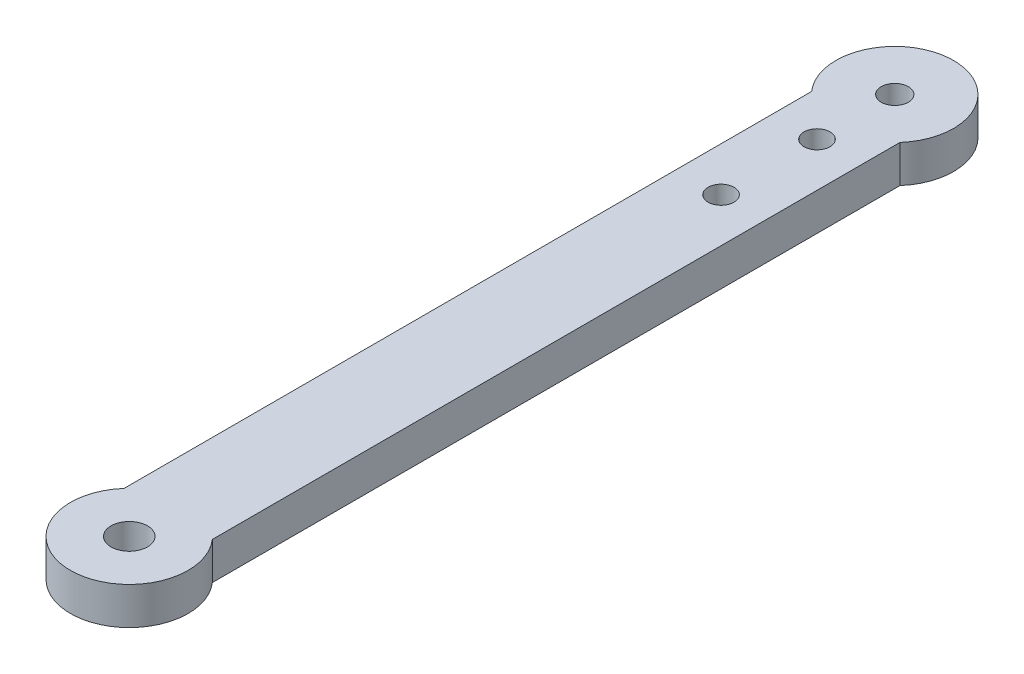
from build123d import *

# Parameters (mm, degrees)
SKETCH1_R           = 1.55
SKETCH1_R_2         = 1.1
SKETCH1_R_3         = 1.15
BOSS_EXTRUDE1_DEPTH = 3.175


with BuildPart() as part:
    # Sketch1 → Boss-Extrude1 (new body)
    with BuildSketch(Plane(origin=(0, 0, 0), x_dir=(1, 0, 0), z_dir=(0, 1, 0))):
        with BuildLine():
            Line((-3.75, -61.692810861), (-3.75, -3.307189139))
            ThreePointArc((-3.75, -3.307189139), (0, 5), (3.75, -3.307189139))
            Line((3.75, -3.307189139), (3.75, -61.692810861))
            ThreePointArc((3.75, -61.692810861), (0, -70), (-3.75, -61.692810861))
        make_face()
        with Locations((0, -65)):
            Circle(SKETCH1_R, mode=Mode.SUBTRACT)
        with Locations((0, -6.6)):
            Circle(SKETCH1_R_2, mode=Mode.SUBTRACT)
        with Locations((0, -14.75)):
            Circle(SKETCH1_R_2, mode=Mode.SUBTRACT)
        Circle(SKETCH1_R_3, mode=Mode.SUBTRACT)
    extrude(amount=BOSS_EXTRUDE1_DEPTH)


solid = part.part
